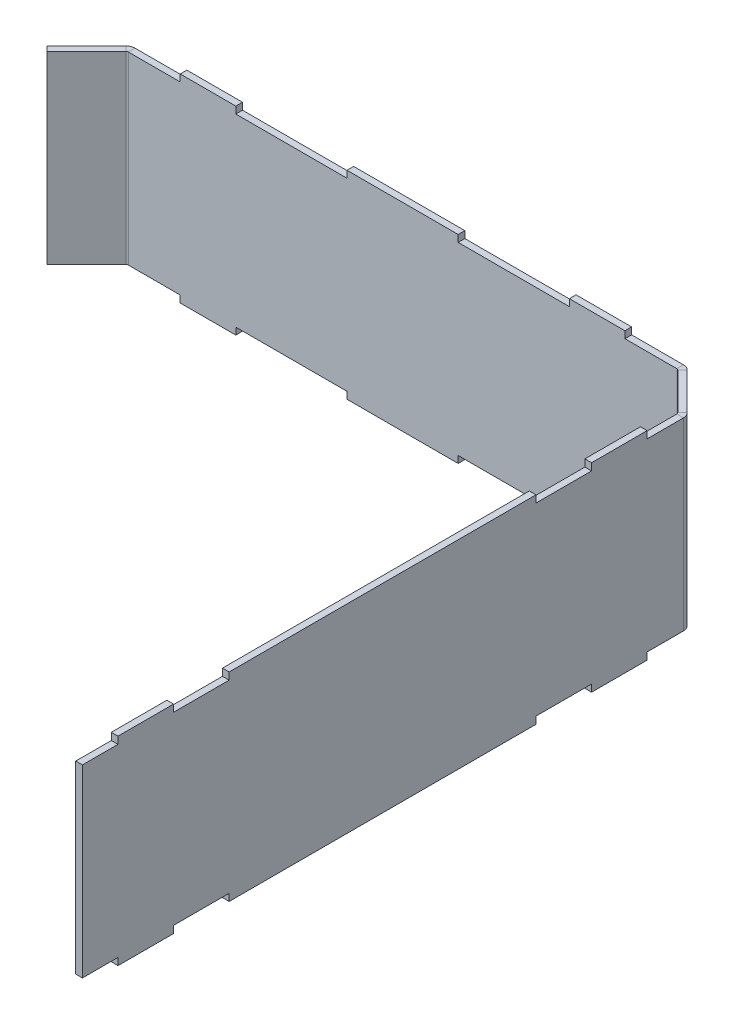
from build123d import *

# Parameters (mm, degrees)
BASE_FLANGE1_DEPTH  = 83
SKETCH2_W           = 50
SKETCH2_H           = 3.1
SKETCH2_W_2         = 25
BOSS_EXTRUDE1_DEPTH = 3
SKETCH3_W           = 138
SKETCH3_H           = 3.2
SKETCH3_W_2         = 25
BOSS_EXTRUDE2_DEPTH = 3


# Sheet-metal steps are written as plain solids
with BuildPart() as part:
    # Sketch1 → Base-Flange1 (new body)
    with BuildSketch(Plane(origin=(0, 0, 0), x_dir=(1, 0, 0), z_dir=(0, 1, 0))):
        with BuildLine():
            Line((-144, 137), (-126.171572875, 154.828427125))
            ThreePointArc((-126.171572875, 154.828427125), (-124.87387948, 155.69551813), (-123.343145751, 156))
            Line((-123.343145751, 156), (123.343145751, 156))
            ThreePointArc((123.343145751, 156), (124.87387948, 155.69551813), (126.171572875, 154.828427125))
            Line((126.171572875, 154.828427125), (142.828427125, 138.171572875))
            ThreePointArc((142.828427125, 138.171572875), (143.69551813, 136.87387948), (144, 135.343145751))
            Line((144, 135.343145751), (144, -135))
            Line((144, -135), (141, -135))
            Line((141, -135), (141, 135.343145751))
            ThreePointArc((141, 135.343145751), (140.923879533, 135.725829183), (140.707106781, 136.050252532))
            Line((140.707106781, 136.050252532), (124.050252532, 152.707106781))
            ThreePointArc((124.050252532, 152.707106781), (123.725829183, 152.923879533), (123.343145751, 153))
            Line((123.343145751, 153), (-123.343145751, 153))
            ThreePointArc((-123.343145751, 153), (-123.725829183, 152.923879533), (-124.050252532, 152.707106781))
            Line((-124.050252532, 152.707106781), (-141.878679656, 134.878679656))
            Line((-141.878679656, 134.878679656), (-144, 137))
        make_face()
    extrude(amount=BASE_FLANGE1_DEPTH)

    # Sketch2 → Boss-Extrude1 (add)
    with BuildSketch(Plane(origin=(0, 0, -156), x_dir=(-1, 0, 0), z_dir=(0, 0, -1))):
        with Locations((0, -1.55)):
            Rectangle(SKETCH2_W, SKETCH2_H)
        with Locations((-87.5, -1.55)):
            Rectangle(SKETCH2_W_2, SKETCH2_H)
        with Locations((87.5, -1.55)):
            Rectangle(SKETCH2_W_2, SKETCH2_H)
    boss_extrude1 = extrude(amount=-BOSS_EXTRUDE1_DEPTH)

    # Sketch3 → Boss-Extrude2 (add)
    with BuildSketch(Plane(origin=(144, 0, 0), x_dir=(0, 0, -1), z_dir=(1, 0, 0))):
        with Locations((0, -1.6)):
            Rectangle(SKETCH3_W, SKETCH3_H)
        with Locations((106.5, -1.6)):
            Rectangle(SKETCH3_W_2, SKETCH3_H)
        with Locations((-106.5, -1.6)):
            Rectangle(SKETCH3_W_2, SKETCH3_H)
    boss_extrude2 = extrude(amount=-BOSS_EXTRUDE2_DEPTH)

    # Mirror1: Boss-Extrude1, Boss-Extrude2 across plane
    add(boss_extrude1.mirror(Plane.ZX.offset(41.5)))
    add(boss_extrude2.mirror(Plane.ZX.offset(41.5)))


solid = part.part
